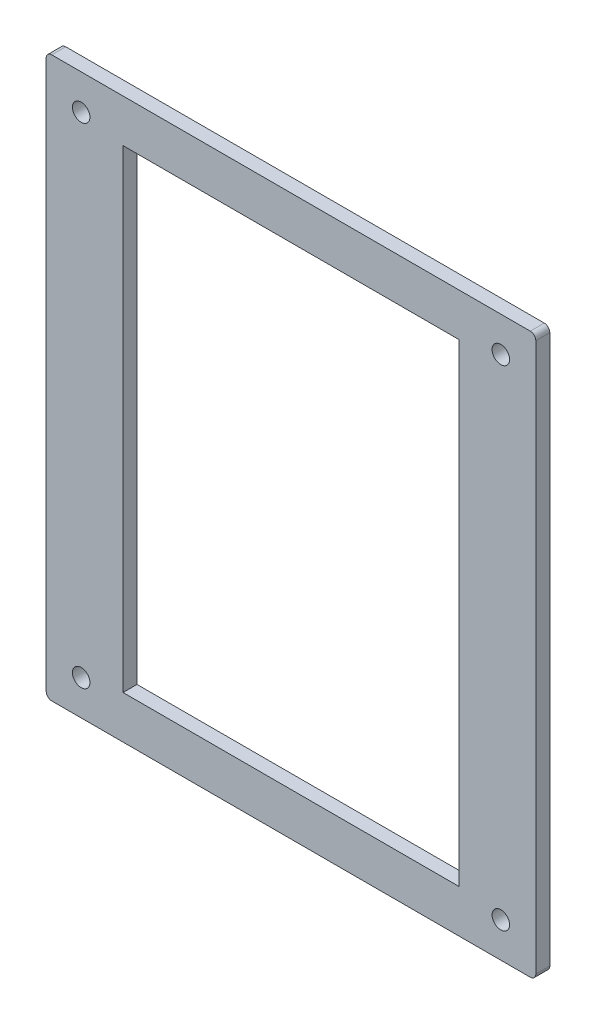
from build123d import *

# Parameters (mm, degrees)
SKETCH1_W           = 88.9
SKETCH1_H           = 101.6
SKETCH1_R           = 1.59
SKETCH1_W_2         = 61
SKETCH1_H_2         = 86
BOSS_EXTRUDE1_DEPTH = 2.54
FILLET1_R           = 1


with BuildPart() as part:
    # Sketch1 → Boss-Extrude1 (new body)
    with BuildSketch(Plane.XY):
        with Locations((44.45, -50.8)):
            Rectangle(SKETCH1_W, SKETCH1_H)
        with Locations((6.35, -6.35)):
            Circle(SKETCH1_R, mode=Mode.SUBTRACT)
        with Locations((82.55, -6.35)):
            Circle(SKETCH1_R, mode=Mode.SUBTRACT)
        with Locations((6.35, -95.25)):
            Circle(SKETCH1_R, mode=Mode.SUBTRACT)
        with Locations((82.55, -95.25)):
            Circle(SKETCH1_R, mode=Mode.SUBTRACT)
        with Locations((44.45, -50.8)):
            Rectangle(SKETCH1_W_2, SKETCH1_H_2, mode=Mode.SUBTRACT)
    extrude(amount=BOSS_EXTRUDE1_DEPTH)

    # Fillet1
    fillet1_edges = [part.edges().sort_by_distance(p)[0] for p in [
        (0, -101.6, 1.27),
        (88.9, -101.6, 1.27),
        (88.9, 0, 1.27),
        (0, 0, 1.27),
    ]]
    fillet(fillet1_edges, radius=FILLET1_R)


solid = part.part
